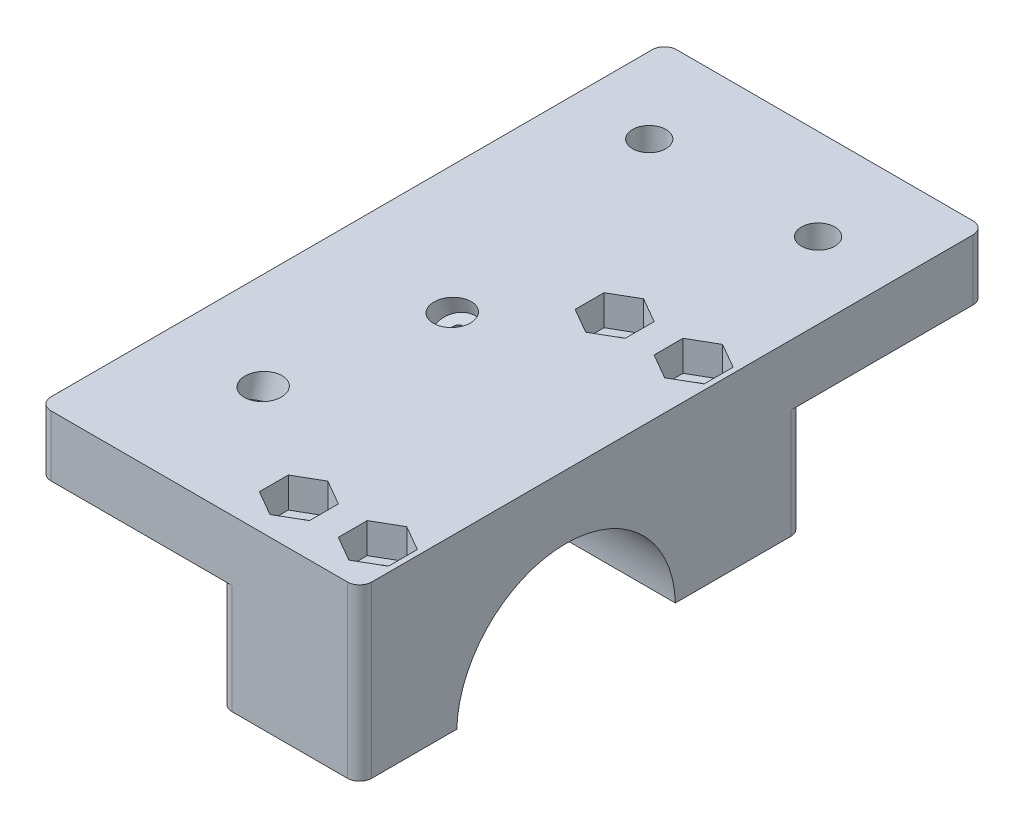
from build123d import *

# Parameters (mm, degrees)
SKETCH1_W                       = 52.809375
SKETCH1_H                       = 85
BOSS_EXTRUDE1_DEPTH             = 10
SPRING_PULLEY_CUTOUT_DEPTH      = 10
SPRING_PULLEY_CUTOUT_DEPTH_BACK = 11
SKETCH2_R                       = 24
BOSS_EXTRUDE4_DEPTH             = 23
SKETCH20_R                      = 2.75
CUT_EXTRUDE8_DEPTH              = 104.912607935
MOVE_START                      = -18
MOVE_FACE1_OUTLINE_W            = 23
MOVE_FACE1_OUTLINE_H            = 5
MOVE_FACE1_DEPTH                = 18
MOVE_FACE3_BY                   = 1
MOVE_FACE4_BY                   = 0.809375
FILLET4_R                       = 2
BOSS_EXTRUDE5_START             = -10
BOSS_EXTRUDE5_DEPTH             = 10
SKETCH38_R                      = 2.75
CUT_EXTRUDE9_DEPTH              = 118.140215502
CUT_EXTRUDE10_DEPTH             = 5


# Read off the part's stored shape, not the designer's step: Move Face1
with BuildPart() as part:
    # Sketch1 → Boss-Extrude1 (new body)
    with BuildSketch(Plane(origin=(0, 0, 0), x_dir=(1, 0, 0), z_dir=(0, 1, 0))):
        with Locations((26.4046875, 42.5)):
            Rectangle(SKETCH1_W, SKETCH1_H)
    extrude(amount=BOSS_EXTRUDE1_DEPTH)

    # Sketch2 → spring_pulley_cutout (cut, two sides: drawn at the far end of the back side and taken through both)
    with BuildSketch(Plane.ZY.offset(-18).offset(-SPRING_PULLEY_CUTOUT_DEPTH_BACK)):
        with Locations((-34, -18.5)):
            Circle(SKETCH2_R)
    extrude(amount=SPRING_PULLEY_CUTOUT_DEPTH + SPRING_PULLEY_CUTOUT_DEPTH_BACK, mode=Mode.SUBTRACT)

    # Sketch34 → Cut-Revolve1 (revolve, cut)
    with BuildSketch(Plane(origin=(16, 0, 0), x_dir=(0, 0, -1), z_dir=(1, 0, 0))):
        Polygon((16.798424815, -5.423086457), (21.139079438, 10.776457135), (24.036856917, 10), (23.001580737, 6.136296695), (21.069729084, 6.653934785), (17.764350642, -5.681905502), align=None)
    revolve(axis=Axis((16, -5.423086457, -16.798424815), (0, 0.9659258262890682, -0.2588190451025213)), mode=Mode.SUBTRACT)

    # Sketch36 → Cut-Revolve2 (revolve, cut)
    with BuildSketch(Plane(origin=(21, 0, 0), x_dir=(0, 0, -1), z_dir=(1, 0, 0)), mode=Mode.PRIVATE) as cut_revolve2_sk:
        Polygon((50.543888978, -2.968568117), (46.860920562, 10.776457135), (43.963143083, 10), (44.998419263, 6.136296695), (46.930270916, 6.653934785), (49.577963152, -3.227387162), align=None)
    revolve(cut_revolve2_sk.sketch.rotate(Axis((21, -2.968568117, -50.543888978), (0, 0.9659258262890665, 0.2588190451025275)), 180), axis=Axis((21, -2.968568117, -50.543888978), (0, 0.9659258262890665, 0.2588190451025275)), mode=Mode.SUBTRACT)

    # Sketch19 → Boss-Extrude4 (add)
    with BuildSketch(Plane.ZY.offset(-29.809375)):
        with BuildLine():
            Line((-68, -18), (-68, 0))
            Line((-68, 0), (0, 0))
            Line((0, 0), (0, -18))
            Line((0, -18), (-16.006945785, -18))
            ThreePointArc((-16.006945785, -18), (-34, -0.5), (-51.993054215, -18))
            Line((-51.993054215, -18), (-68, -18))
        make_face()
    extrude(amount=-BOSS_EXTRUDE4_DEPTH)

    # Sketch20 → Cut-Extrude8 (cut, through all)
    with BuildSketch(Plane(origin=(0, -18, 0), x_dir=(-1, 0, 0), z_dir=(0, -1, 0))):
        with Locations(Location((-47.809375, 8.003472892, 0), (0, 0, 90))):
            Circle(SKETCH20_R)
        with Locations(Location((-34.809375, 8.003472892, 0), (0, 0, 90))):
            Circle(SKETCH20_R)
        with Locations(Location((-47.809375, 59.996527108, 0), (0, 0, 90))):
            Circle(SKETCH20_R)
        with Locations(Location((-34.809375, 59.996527108, 0), (0, 0, 90))):
            Circle(SKETCH20_R)
    extrude(amount=-CUT_EXTRUDE8_DEPTH, mode=Mode.SUBTRACT)

    # Move Face1 outline → Move Face1 (add)
    with BuildSketch(Plane(origin=(0, 0, 0), x_dir=(1, 0, 0), z_dir=(0, 1, 0)).offset(MOVE_START)):
        with Locations((41.309375, 70.5)):
            Rectangle(MOVE_FACE1_OUTLINE_W, MOVE_FACE1_OUTLINE_H)
    extrude(amount=MOVE_FACE1_DEPTH)

    # Move Face3: a face moved inward by 1.0
    extrude(part.faces().sort_by_distance((8, 2.223147927, -34))[0], amount=MOVE_FACE3_BY, dir=(-1, 0, 0), mode=Mode.SUBTRACT)

    # Move Face4: a face moved inward by 0.809375
    extrude(part.faces().sort_by_distance((29, 2.223147927, -34))[0], amount=MOVE_FACE4_BY, dir=(1, 0, 0), mode=Mode.SUBTRACT)

    # Fillet4
    fillet4_edges = [part.edges().sort_by_distance(p)[0] for p in [
        (52.809375, -9, -73),
        (29.809375, -9, 0),
        (29.809375, -9, -73),
        (0, 5, -85),
        (52.809375, 5, -85),
        (52.809375, -4, 0),
        (0, 5, 0),
    ]]
    fillet(fillet4_edges, radius=FILLET4_R)

    # Sketch37 → Boss-Extrude5 (add)
    with BuildSketch(Plane.XZ.offset(BOSS_EXTRUDE5_START)):
        with BuildLine():
            Line((0, -83), (0, -101))
            ThreePointArc((0, -101), (0.585786438, -102.414213562), (2, -103))
            Line((2, -103), (50.809375, -103))
            ThreePointArc((50.809375, -103), (52.223588562, -102.414213562), (52.809375, -101))
            Line((52.809375, -101), (52.809375, -83))
            ThreePointArc((52.809375, -83), (52.223588562, -84.414213562), (50.809375, -85))
            Line((50.809375, -85), (2, -85))
            ThreePointArc((2, -85), (0.585786438, -84.414213562), (0, -83))
        make_face()
    extrude(amount=BOSS_EXTRUDE5_DEPTH)

    # Sketch38 → Cut-Extrude9 (cut, through all)
    with BuildSketch(Plane.XZ):
        with Locations(Location((12.5, -88, 0), (0, 0, 270))):
            Circle(SKETCH38_R)
        with Locations(Location((40.309375, -88, 0), (0, 0, 270))):
            Circle(SKETCH38_R)
    extrude(amount=-CUT_EXTRUDE9_DEPTH, mode=Mode.SUBTRACT)

    # Sketch39 → Cut-Extrude10 (cut)
    with BuildSketch(Plane(origin=(0, 10, 0), x_dir=(1, 0, 0), z_dir=(0, 1, 0))):
        Polygon((47.809375, 64.759666829), (43.684375, 62.378096968), (43.684375, 57.614957247), (47.809375, 55.233387387), (51.934375, 57.614957247), (51.934375, 62.378096968), align=None)
        Polygon((34.809375, 64.759666829), (30.684375, 62.378096968), (30.684375, 57.614957247), (34.809375, 55.233387387), (38.934375, 57.614957247), (38.934375, 62.378096968), align=None)
        Polygon((34.809375, 12.766612613), (30.684375, 10.385042753), (30.684375, 5.621903032), (34.809375, 3.240333171), (38.934375, 5.621903032), (38.934375, 10.385042753), align=None)
        Polygon((47.809375, 12.766612613), (43.684375, 10.385042753), (43.684375, 5.621903032), (47.809375, 3.240333171), (51.934375, 5.621903032), (51.934375, 10.385042753), align=None)
    extrude(amount=-CUT_EXTRUDE10_DEPTH, mode=Mode.SUBTRACT)


solid = part.part
